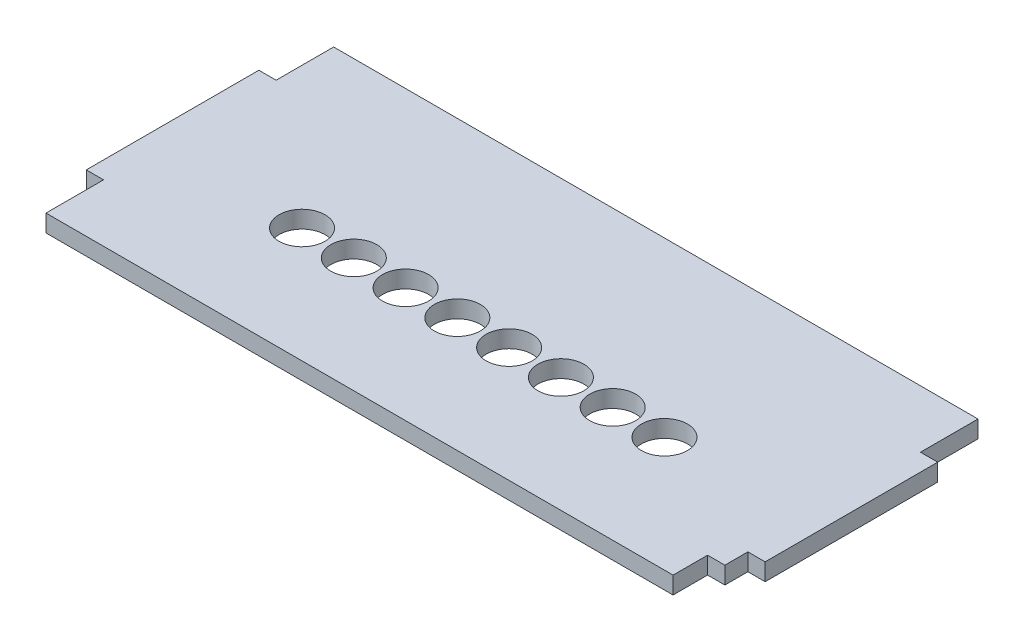
from build123d import *

# Parameters (mm, degrees)
LED_1_OUTLINE_R     = 2.25
LED_1_DEPTH         = 3
SKETCH_1_R          = 4
CUT_EXTRUDE_1_DEPTH = 3


# Read off the part's stored shape, not the designer's step: 基体零件-LED板-1
with BuildPart() as part:
    # 基体零件-LED板-1 outline → 基体零件-LED板-1 (new body)
    with BuildSketch(Plane(origin=(0, 0, 0), x_dir=(1, 0, 0), z_dir=(0, 1, 0))):
        Polygon((-3, -140), (0, -140), (0, -110), (-3, -110), (-3, -100), (-115, -100), (-115, -110), (-118, -110), (-118, -140), (-115, -140), (-115, -150), (-6.001970153, -150), (-6.001970153, -144), (-3, -144), align=None)
        with Locations((-90.5, -130)):
            Circle(LED_1_OUTLINE_R, mode=Mode.SUBTRACT)
        with Locations((-81.5, -130)):
            Circle(LED_1_OUTLINE_R, mode=Mode.SUBTRACT)
        with Locations((-72.5, -130)):
            Circle(LED_1_OUTLINE_R, mode=Mode.SUBTRACT)
        with Locations((-63.5, -130)):
            Circle(LED_1_OUTLINE_R, mode=Mode.SUBTRACT)
        with Locations((-54.5, -130)):
            Circle(LED_1_OUTLINE_R, mode=Mode.SUBTRACT)
        with Locations((-45.5, -130)):
            Circle(LED_1_OUTLINE_R, mode=Mode.SUBTRACT)
        with Locations((-36.5, -130)):
            Circle(LED_1_OUTLINE_R, mode=Mode.SUBTRACT)
        with Locations((-27.5, -130)):
            Circle(LED_1_OUTLINE_R, mode=Mode.SUBTRACT)
    extrude(amount=LED_1_DEPTH)

    # 草图1 → 切除-拉伸1 (cut)
    with BuildSketch(Plane(origin=(0, 3, 0), x_dir=(1, 0, 0), z_dir=(0, 1, 0))):
        with Locations(Location((-90.5, -130, 0), (0, 0, 270))):
            Circle(SKETCH_1_R)
        with Locations(Location((-81.5, -130, 0), (0, 0, 270))):
            Circle(SKETCH_1_R)
        with Locations(Location((-72.5, -130, 0), (0, 0, 270))):
            Circle(SKETCH_1_R)
        with Locations(Location((-63.5, -130, 0), (0, 0, 270))):
            Circle(SKETCH_1_R)
        with Locations(Location((-54.5, -130, 0), (0, 0, 270))):
            Circle(SKETCH_1_R)
        with Locations(Location((-45.5, -130, 0), (0, 0, 270))):
            Circle(SKETCH_1_R)
        with Locations(Location((-36.5, -130, 0), (0, 0, 270))):
            Circle(SKETCH_1_R)
        with Locations(Location((-27.5, -130, 0), (0, 0, 270))):
            Circle(SKETCH_1_R)
    extrude(amount=-CUT_EXTRUDE_1_DEPTH, mode=Mode.SUBTRACT)


solid = part.part
